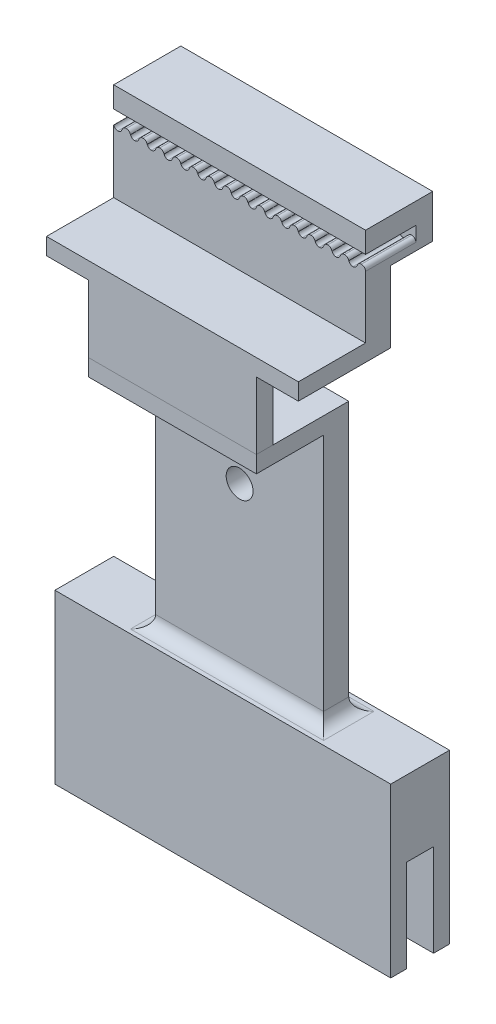
from build123d import *

# Parameters (mm, degrees)
IZIM1_W                          = 40
IZIM1_H                          = 7
Y_KSEKLIK_EKSTR_ZYON1_DEPTH      = 20
IZIM2_W                          = 40
IZIM2_H                          = 3.2
KES_EKSTR_ZYON1_DEPTH            = 11
Y_KSEKLIK_EKSTR_ZYON2_START      = -1.5
Y_KSEKLIK_EKSTR_ZYON2_OUTLINE_W  = 20
Y_KSEKLIK_EKSTR_ZYON2_OUTLINE_H  = 40
Y_KSEKLIK_EKSTR_ZYON2_OUTLINE_R  = 1.6
Y_KSEKLIK_EKSTR_ZYON2_DEPTH      = 3
RADYUS1_R                        = 1.5
IZIM7_W                          = 30
IZIM7_H                          = 3
Y_KSEKLIK_EKSTR_ZYON4_DEPTH      = 8.5
Y_KSEKLIK_EKSTR_ZYON5_DEPTH      = 3
Y_KSEKLIK_EKSTR_ZYON5_DEPTH_BACK = 3
IZIM8_W                          = 30
IZIM8_H                          = 2.5
IZIM9_W                          = 30
IZIM9_H                          = 5.14
Y_KSEKLIK_EKSTR_ZYON6_DEPTH      = 2
Y_KSEKLIK_EKSTR_ZYON7_DEPTH      = 8
IZIM12_W                         = 20
IZIM12_H                         = 8
KES_EKSTR_ZYON3_DEPTH            = 9
IZIM14_W                         = 20
IZIM14_H                         = 2
Y_KSEKLIK_EKSTR_ZYON8_DEPTH      = 8
IZIM15_W                         = 20
IZIM15_H                         = 2
Y_KSEKLIK_EKSTR_ZYON9_DEPTH      = 3
KES_EKSTR_ZYON4_DEPTH            = 10
KES_EKSTR_ZYON4_DEPTH_BACK       = 10
IZIM17_R                         = 1.6
IZIM18_R                         = 1.6
Y_KSEKLIK_EKSTR_ZYON10_DEPTH     = 3
AY_R1_SURFACE_1_BACK             = 86.316
AY_R1_SURFACE_1_DEPTH            = 172.632
AY_R1_SURFACE_2_BACK             = 86.316
AY_R1_SURFACE_2_DEPTH            = 172.632


# Read off the part's stored shape, not the designer's step: Yükseklik-Ekstrüzyon2
with BuildPart() as part:
    # Çizim1 → Yükseklik-Ekstrüzyon1 (new body)
    with BuildSketch(Plane(origin=(0, 0, 0), x_dir=(1, 0, 0), z_dir=(0, 1, 0))):
        Rectangle(IZIM1_W, IZIM1_H)
    extrude(amount=-Y_KSEKLIK_EKSTR_ZYON1_DEPTH)

    # Çizim2 → Kes-Ekstrüzyon1 (cut)
    with BuildSketch(Plane.XZ.offset(20)):
        Rectangle(IZIM2_W, IZIM2_H)
    extrude(amount=-KES_EKSTR_ZYON1_DEPTH, mode=Mode.SUBTRACT)

    # Yükseklik-Ekstrüzyon2 outline → Yükseklik-Ekstrüzyon2 (add)
    with BuildSketch(Plane.XY.offset(Y_KSEKLIK_EKSTR_ZYON2_START)):
        with Locations((0, 20)):
            Rectangle(Y_KSEKLIK_EKSTR_ZYON2_OUTLINE_W, Y_KSEKLIK_EKSTR_ZYON2_OUTLINE_H)
        with Locations((0, 10)):
            Circle(Y_KSEKLIK_EKSTR_ZYON2_OUTLINE_R, mode=Mode.SUBTRACT)
    extrude(amount=Y_KSEKLIK_EKSTR_ZYON2_DEPTH)

    # Radyus1
    radyus1_edges = [part.edges().sort_by_distance(p)[0] for p in [
        (-10, 0, 0),
        (10, 0, 0),
        (0, 0, -1.5),
        (0, 0, 1.5),
    ]]
    fillet(radyus1_edges, radius=RADYUS1_R)

    # Çizim7 → Yükseklik-Ekstrüzyon4 (add)
    with BuildSketch(Plane(origin=(0, 40, 0), x_dir=(1, 0, 0), z_dir=(0, 1, 0))):
        Rectangle(IZIM7_W, IZIM7_H)
    extrude(amount=Y_KSEKLIK_EKSTR_ZYON4_DEPTH)

    # Çizim8 → Yükseklik-Ekstrüzyon5 (add, two sides: drawn at the far end of the back side and taken through both)
    with BuildSketch(Plane(origin=(0, 0, -1.5), x_dir=(-1, 0, 0), z_dir=(0, 0, -1)).offset(-Y_KSEKLIK_EKSTR_ZYON5_DEPTH_BACK)):
        with Locations((0, 52.39)):
            Rectangle(IZIM8_W, IZIM8_H)
        with BuildLine():
            Line((15, 49.490709154), (14.982635036, 49.490709154))
            ThreePointArc((14.982635036, 49.490709154), (14.807277215, 49.230479452), (14.51, 49.13))
            Line((14.51, 49.13), (14.49, 49.13))
            ThreePointArc((14.49, 49.13), (14.192722785, 49.230479452), (14.017364964, 49.490709154))
            Line((14.017364964, 49.490709154), (13.989539014, 49.490709154))
            ThreePointArc((13.989539014, 49.490709154), (13.818830467, 49.770425739), (13.51, 49.88))
            Line((13.51, 49.88), (13.49, 49.88))
            ThreePointArc((13.49, 49.88), (13.181169533, 49.770425739), (13.010460986, 49.490709154))
            Line((13.010460986, 49.490709154), (12.982635036, 49.490709154))
            ThreePointArc((12.982635036, 49.490709154), (12.807277215, 49.230479452), (12.51, 49.13))
            Line((12.51, 49.13), (12.49, 49.13))
            ThreePointArc((12.49, 49.13), (12.192722785, 49.230479452), (12.017364964, 49.490709154))
            Line((12.017364964, 49.490709154), (11.989539014, 49.490709154))
            ThreePointArc((11.989539014, 49.490709154), (11.818830467, 49.770425739), (11.51, 49.88))
            Line((11.51, 49.88), (11.49, 49.88))
            ThreePointArc((11.49, 49.88), (11.181169533, 49.770425739), (11.010460986, 49.490709154))
            Line((11.010460986, 49.490709154), (10.982635036, 49.490709154))
            ThreePointArc((10.982635036, 49.490709154), (10.807277215, 49.230479452), (10.51, 49.13))
            Line((10.51, 49.13), (10.49, 49.13))
            ThreePointArc((10.49, 49.13), (10.192722785, 49.230479452), (10.017364964, 49.490709154))
            Line((10.017364964, 49.490709154), (9.989539014, 49.490709154))
            ThreePointArc((9.989539014, 49.490709154), (9.818830467, 49.770425739), (9.51, 49.88))
            Line((9.51, 49.88), (9.49, 49.88))
            ThreePointArc((9.49, 49.88), (9.181169533, 49.770425739), (9.010460986, 49.490709154))
            Line((9.010460986, 49.490709154), (8.982635036, 49.490709154))
            ThreePointArc((8.982635036, 49.490709154), (8.807277215, 49.230479452), (8.51, 49.13))
            Line((8.51, 49.13), (8.49, 49.13))
            ThreePointArc((8.49, 49.13), (8.192722785, 49.230479452), (8.017364964, 49.490709154))
            Line((8.017364964, 49.490709154), (7.989539014, 49.490709154))
            ThreePointArc((7.989539014, 49.490709154), (7.818830467, 49.770425739), (7.51, 49.88))
            Line((7.51, 49.88), (7.49, 49.88))
            ThreePointArc((7.49, 49.88), (7.181169533, 49.770425739), (7.010460986, 49.490709154))
            Line((7.010460986, 49.490709154), (6.982635036, 49.490709154))
            ThreePointArc((6.982635036, 49.490709154), (6.807277215, 49.230479452), (6.51, 49.13))
            Line((6.51, 49.13), (6.49, 49.13))
            ThreePointArc((6.49, 49.13), (6.192722785, 49.230479452), (6.017364964, 49.490709154))
            Line((6.017364964, 49.490709154), (5.989539014, 49.490709154))
            ThreePointArc((5.989539014, 49.490709154), (5.818830467, 49.770425739), (5.51, 49.88))
            Line((5.51, 49.88), (5.49, 49.88))
            ThreePointArc((5.49, 49.88), (5.181169533, 49.770425739), (5.010460986, 49.490709154))
            Line((5.010460986, 49.490709154), (4.982635036, 49.490709154))
            ThreePointArc((4.982635036, 49.490709154), (4.807277215, 49.230479452), (4.51, 49.13))
            Line((4.51, 49.13), (4.49, 49.13))
            ThreePointArc((4.49, 49.13), (4.192722785, 49.230479452), (4.017364964, 49.490709154))
            Line((4.017364964, 49.490709154), (3.989539014, 49.490709154))
            ThreePointArc((3.989539014, 49.490709154), (3.818830467, 49.770425739), (3.51, 49.88))
            Line((3.51, 49.88), (3.49, 49.88))
            ThreePointArc((3.49, 49.88), (3.181169533, 49.770425739), (3.010460986, 49.490709154))
            Line((3.010460986, 49.490709154), (2.982635036, 49.490709154))
            ThreePointArc((2.982635036, 49.490709154), (2.807277215, 49.230479452), (2.51, 49.13))
            Line((2.51, 49.13), (2.49, 49.13))
            ThreePointArc((2.49, 49.13), (2.192722785, 49.230479452), (2.017364964, 49.490709154))
            Line((2.017364964, 49.490709154), (1.989539014, 49.490709154))
            ThreePointArc((1.989539014, 49.490709154), (1.818830467, 49.770425739), (1.51, 49.88))
            Line((1.51, 49.88), (1.49, 49.88))
            ThreePointArc((1.49, 49.88), (1.181169533, 49.770425739), (1.010460986, 49.490709154))
            Line((1.010460986, 49.490709154), (0.982635036, 49.490709154))
            ThreePointArc((0.982635036, 49.490709154), (0.807277215, 49.230479452), (0.51, 49.13))
            Line((0.51, 49.13), (0.49, 49.13))
            ThreePointArc((0.49, 49.13), (0.192722785, 49.230479452), (0.017364964, 49.490709154))
            Line((0.017364964, 49.490709154), (-0.010460986, 49.490709154))
            ThreePointArc((-0.010460986, 49.490709154), (-0.181169533, 49.770425739), (-0.49, 49.88))
            Line((-0.49, 49.88), (-0.51, 49.88))
            ThreePointArc((-0.51, 49.88), (-0.818830467, 49.770425739), (-0.989539014, 49.490709154))
            Line((-0.989539014, 49.490709154), (-1.017364964, 49.490709154))
            ThreePointArc((-1.017364964, 49.490709154), (-1.192722785, 49.230479452), (-1.49, 49.13))
            Line((-1.49, 49.13), (-1.51, 49.13))
            ThreePointArc((-1.51, 49.13), (-1.807277215, 49.230479452), (-1.982635036, 49.490709154))
            Line((-1.982635036, 49.490709154), (-2.010460986, 49.490709154))
            ThreePointArc((-2.010460986, 49.490709154), (-2.181169533, 49.770425739), (-2.49, 49.88))
            Line((-2.49, 49.88), (-2.51, 49.88))
            ThreePointArc((-2.51, 49.88), (-2.818830467, 49.770425739), (-2.989539014, 49.490709154))
            Line((-2.989539014, 49.490709154), (-3.017364964, 49.490709154))
            ThreePointArc((-3.017364964, 49.490709154), (-3.192722785, 49.230479452), (-3.49, 49.13))
            Line((-3.49, 49.13), (-3.51, 49.13))
            ThreePointArc((-3.51, 49.13), (-3.807277215, 49.230479452), (-3.982635036, 49.490709154))
            Line((-3.982635036, 49.490709154), (-4.010460986, 49.490709154))
            ThreePointArc((-4.010460986, 49.490709154), (-4.181169533, 49.770425739), (-4.49, 49.88))
            Line((-4.49, 49.88), (-4.51, 49.88))
            ThreePointArc((-4.51, 49.88), (-4.818830467, 49.770425739), (-4.989539014, 49.490709154))
            Line((-4.989539014, 49.490709154), (-5.017364964, 49.490709154))
            ThreePointArc((-5.017364964, 49.490709154), (-5.192722785, 49.230479452), (-5.49, 49.13))
            Line((-5.49, 49.13), (-5.51, 49.13))
            ThreePointArc((-5.51, 49.13), (-5.807277215, 49.230479452), (-5.982635036, 49.490709154))
            Line((-5.982635036, 49.490709154), (-6.010460986, 49.490709154))
            ThreePointArc((-6.010460986, 49.490709154), (-6.181169533, 49.770425739), (-6.49, 49.88))
            Line((-6.49, 49.88), (-6.51, 49.88))
            ThreePointArc((-6.51, 49.88), (-6.818830467, 49.770425739), (-6.989539014, 49.490709154))
            Line((-6.989539014, 49.490709154), (-7.017364964, 49.490709154))
            ThreePointArc((-7.017364964, 49.490709154), (-7.192722785, 49.230479452), (-7.49, 49.13))
            Line((-7.49, 49.13), (-7.51, 49.13))
            ThreePointArc((-7.51, 49.13), (-7.807277215, 49.230479452), (-7.982635036, 49.490709154))
            Line((-7.982635036, 49.490709154), (-8.010460986, 49.490709154))
            ThreePointArc((-8.010460986, 49.490709154), (-8.181169533, 49.770425739), (-8.49, 49.88))
            Line((-8.49, 49.88), (-8.51, 49.88))
            ThreePointArc((-8.51, 49.88), (-8.818830467, 49.770425739), (-8.989539014, 49.490709154))
            Line((-8.989539014, 49.490709154), (-9.017364964, 49.490709154))
            ThreePointArc((-9.017364964, 49.490709154), (-9.192722785, 49.230479452), (-9.49, 49.13))
            Line((-9.49, 49.13), (-9.51, 49.13))
            ThreePointArc((-9.51, 49.13), (-9.807277215, 49.230479452), (-9.982635036, 49.490709154))
            Line((-9.982635036, 49.490709154), (-10.010460986, 49.490709154))
            ThreePointArc((-10.010460986, 49.490709154), (-10.181169533, 49.770425739), (-10.49, 49.88))
            Line((-10.49, 49.88), (-10.51, 49.88))
            ThreePointArc((-10.51, 49.88), (-10.818830467, 49.770425739), (-10.989539014, 49.490709154))
            Line((-10.989539014, 49.490709154), (-11.017364964, 49.490709154))
            ThreePointArc((-11.017364964, 49.490709154), (-11.192722785, 49.230479452), (-11.49, 49.13))
            Line((-11.49, 49.13), (-11.51, 49.13))
            ThreePointArc((-11.51, 49.13), (-11.807277215, 49.230479452), (-11.982635036, 49.490709154))
            Line((-11.982635036, 49.490709154), (-12.010460986, 49.490709154))
            ThreePointArc((-12.010460986, 49.490709154), (-12.181169533, 49.770425739), (-12.49, 49.88))
            Line((-12.49, 49.88), (-12.51, 49.88))
            ThreePointArc((-12.51, 49.88), (-12.818830467, 49.770425739), (-12.989539014, 49.490709154))
            Line((-12.989539014, 49.490709154), (-13.017364964, 49.490709154))
            ThreePointArc((-13.017364964, 49.490709154), (-13.192722785, 49.230479452), (-13.49, 49.13))
            Line((-13.49, 49.13), (-13.51, 49.13))
            ThreePointArc((-13.51, 49.13), (-13.807277215, 49.230479452), (-13.982635036, 49.490709154))
            Line((-13.982635036, 49.490709154), (-14.010460986, 49.490709154))
            ThreePointArc((-14.010460986, 49.490709154), (-14.181169533, 49.770425739), (-14.49, 49.88))
            Line((-14.49, 49.88), (-14.51, 49.88))
            ThreePointArc((-14.51, 49.88), (-14.856482323, 49.736482323), (-15, 49.39))
            Line((-15, 49.39), (-15, 48.5))
            Line((-15, 48.5), (15, 48.5))
            Line((15, 48.5), (15, 49.490709154))
        make_face()
    extrude(amount=Y_KSEKLIK_EKSTR_ZYON5_DEPTH + Y_KSEKLIK_EKSTR_ZYON5_DEPTH_BACK)


with BuildPart() as y_kseklik_ekstr_zyon5_piece_1:
    # of the separate pieces the step leaves, piece 1, a body of its own (y_kseklik_ekstr_zyon5_pieces)
    add(part.part.solids().sort_by_distance((-15, 49.490709154, 1.5))[0])



with BuildPart() as y_kseklik_ekstr_zyon5_piece_2:
    # of the separate pieces the step leaves, piece 2, a body of its own (y_kseklik_ekstr_zyon5_pieces)
    add(part.part.solids().sort_by_distance((15, 53.64, -4.5))[0])


with BuildPart() as y_kseklik_ekstr_zyon5_piece_1_1:
    add(y_kseklik_ekstr_zyon5_piece_1.part)

    add(y_kseklik_ekstr_zyon5_piece_2.part)  # Yükseklik-Ekstrüzyon6 merges Yükseklik-Ekstrüzyon5 piece 2
    # Çizim9 → Yükseklik-Ekstrüzyon6 (add)
    with BuildSketch(Plane(origin=(0, 0, -4.5), x_dir=(-1, 0, 0), z_dir=(0, 0, -1))):
        with Locations((0, 51.07)):
            Rectangle(IZIM9_W, IZIM9_H)
    extrude(amount=Y_KSEKLIK_EKSTR_ZYON6_DEPTH)

    # Çizim11 → Yükseklik-Ekstrüzyon7 (add)
    with BuildSketch(Plane.XY.offset(1.5)):
        Polygon((-10, 40), (-10, 35), (10, 35), (10, 40), (15, 40), (15, 42), (-15, 42), (-15, 40), align=None)
    extrude(amount=Y_KSEKLIK_EKSTR_ZYON7_DEPTH)

    # Çizim12 → Kes-Ekstrüzyon3 (cut)
    with BuildSketch(Plane(origin=(0, 0, -1.5), x_dir=(-1, 0, 0), z_dir=(0, 0, -1))):
        with Locations((0, 36)):
            Rectangle(IZIM12_W, IZIM12_H)
    extrude(amount=-KES_EKSTR_ZYON3_DEPTH, mode=Mode.SUBTRACT)


with BuildPart() as kes_ekstr_zyon3_piece_1:
    # of the separate pieces the step leaves, piece 1, a body of its own (kes_ekstr_zyon3_pieces)
    add(y_kseklik_ekstr_zyon5_piece_1_1.part.solids().sort_by_distance((10, 1.5, -1.5))[0])

    # Çizim14 → Yükseklik-Ekstrüzyon8 (add)
    with BuildSketch(Plane.XY.offset(1.5)):
        with Locations((0, 31)):
            Rectangle(IZIM14_W, IZIM14_H)
    extrude(amount=Y_KSEKLIK_EKSTR_ZYON8_DEPTH)



with BuildPart() as kes_ekstr_zyon3_piece_2:
    # of the separate pieces the step leaves, piece 2, a body of its own (kes_ekstr_zyon3_pieces)
    add(y_kseklik_ekstr_zyon5_piece_1_1.part.solids().sort_by_distance((15, 53.64, -6.5))[0])


with BuildPart() as kes_ekstr_zyon3_piece_1_1:
    add(kes_ekstr_zyon3_piece_1.part)

    add(kes_ekstr_zyon3_piece_2.part)  # Yükseklik-Ekstrüzyon9 merges Kes-Ekstrüzyon3 piece 2
    # Çizim15 → Yükseklik-Ekstrüzyon9 (add)
    with BuildSketch(Plane.XZ.offset(-35)):
        with Locations((0, 8.5)):
            Rectangle(IZIM15_W, IZIM15_H)
    extrude(amount=Y_KSEKLIK_EKSTR_ZYON9_DEPTH)

    # Çizim17 → Kes-Ekstrüzyon4 (cut, two sides: drawn at the far end of the back side and taken through both)
    with BuildSketch(Plane(origin=(0, 0, -1.5), x_dir=(-1, 0, 0), z_dir=(0, 0, -1)).offset(-KES_EKSTR_ZYON4_DEPTH_BACK)):
        with Locations((0, 20)):
            Circle(IZIM17_R)
    extrude(amount=KES_EKSTR_ZYON4_DEPTH + KES_EKSTR_ZYON4_DEPTH_BACK, mode=Mode.SUBTRACT)

    # Çizim18 → Yükseklik-Ekstrüzyon10 (add)
    with BuildSketch(Plane(origin=(0, 0, -1.5), x_dir=(-1, 0, 0), z_dir=(0, 0, -1))):
        with Locations((0, 10)):
            Circle(IZIM18_R)
    extrude(amount=-Y_KSEKLIK_EKSTR_ZYON10_DEPTH)


with BuildPart() as body_2:
    # Ayır1: the piece behind the surface
    add(kes_ekstr_zyon3_piece_1_1.part)
    # Ayır1 surface: a surface, the sketch's curves swept straight by 172.632 mm
    with BuildLine(Plane.XY.offset(-AY_R1_SURFACE_1_BACK), mode=Mode.PRIVATE) as ay_r1_surface_1_path:
        Line((-10, 32), (10, 32))
    ay_r1_surface_1 = Shell.extrude(ay_r1_surface_1_path.wire(), (0 * AY_R1_SURFACE_1_DEPTH, 0 * AY_R1_SURFACE_1_DEPTH, 1 * AY_R1_SURFACE_1_DEPTH))
    split(bisect_by=ay_r1_surface_1, keep=Keep.BOTTOM)


with BuildPart() as kes_ekstr_zyon3_piece_1_2:
    add(kes_ekstr_zyon3_piece_1_1.part)

    # Ayır1: split by a surface, the side it looks to stays
    # Ayır1 surface: a surface, the sketch's curves swept straight by 172.632 mm
    with BuildLine(Plane.XY.offset(-AY_R1_SURFACE_2_BACK), mode=Mode.PRIVATE) as ay_r1_surface_2_path:
        Line((-10, 32), (10, 32))
    ay_r1_surface_2 = Shell.extrude(ay_r1_surface_2_path.wire(), (0 * AY_R1_SURFACE_2_DEPTH, 0 * AY_R1_SURFACE_2_DEPTH, 1 * AY_R1_SURFACE_2_DEPTH))
    split(bisect_by=ay_r1_surface_2, keep=Keep.TOP)


solid = Compound([body_2.part, kes_ekstr_zyon3_piece_1_2.part])
